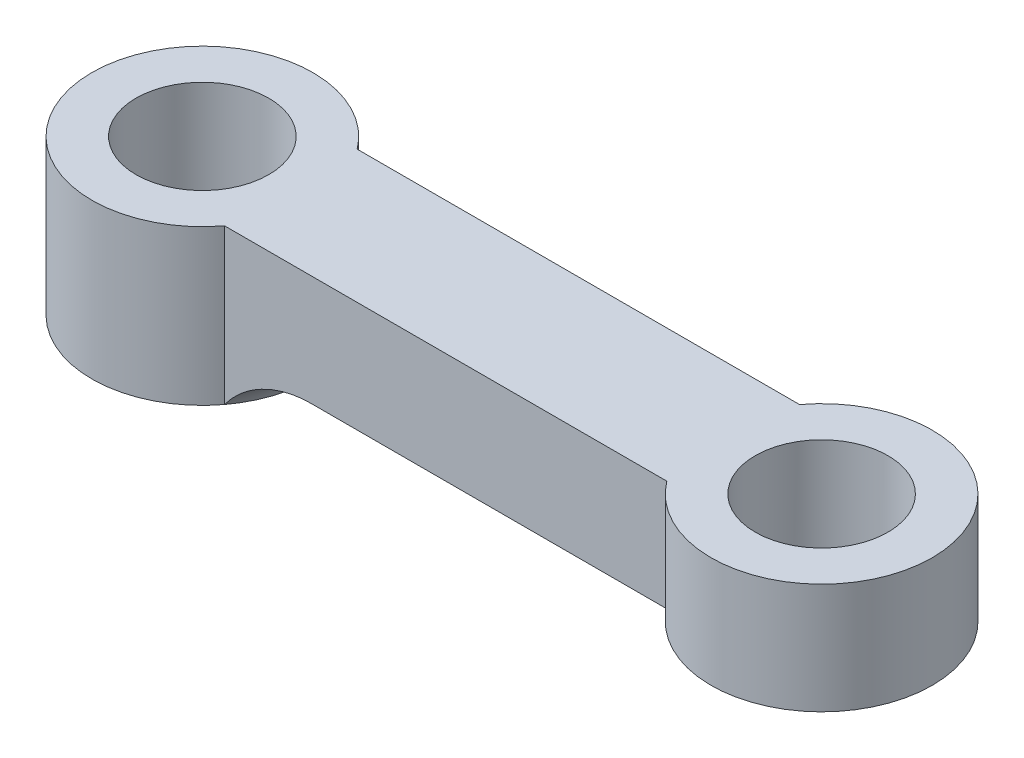
from build123d import *

# Parameters (mm, degrees)
BOSS_EXTRUDE1_DEPTH = 10
BOSS_EXTRUDE2_START = -10
SKETCH3_R           = 2.5
SKETCH3_R_2         = 2
BOSS_EXTRUDE2_DEPTH = 10
MOVE_FACE1_BY       = 5
SKETCH4_R           = 2.5
SKETCH4_R_2         = 1.5
BOSS_EXTRUDE3_DEPTH = 5
SKETCH5_R           = 1.5
CUT_EXTRUDE1_DEPTH  = 5
MOVE_FACE2_BY       = 1
SKETCH11_R          = 1.5
CUT_EXTRUDE2_DEPTH  = 0.75
SKETCH12_R          = 1.5
CUT_EXTRUDE3_DEPTH  = 0.75
FILLET1_R           = 1
SKETCH13_W          = 8
SKETCH13_H          = 3
CUT_EXTRUDE4_DEPTH  = 0.75
SKETCH14_W          = 8
SKETCH14_H          = 3
CUT_EXTRUDE5_DEPTH  = 0.75
BOSS_EXTRUDE6_START = 1
SKETCH16_R          = 2.5
SKETCH16_R_2        = 1.5
BOSS_EXTRUDE6_DEPTH = 1
FILLET3_R           = 2


with BuildPart() as part:
    # Sketch2 → Boss-Extrude1 (new body)
    with BuildSketch(Plane(origin=(0, 0, 0), x_dir=(1, 0, 0), z_dir=(0, 1, 0))):
        with BuildLine():
            Line((0, -1.5), (0, 0))
            Line((0, 0), (-12, 0))
            ThreePointArc((-12, 0), (-12.177124344, -0.822875656), (-12.677124344, -1.5))
            Line((-12.677124344, -1.5), (0, -1.5))
        make_face()
        with BuildLine():
            Line((-12, 0), (0, 0))
            Line((0, 0), (0, 1.5))
            Line((0, 1.5), (-12.677124344, 1.5))
            ThreePointArc((-12.677124344, 1.5), (-12.177124344, 0.822875656), (-12, 0))
        make_face()
        with BuildLine():
            ThreePointArc((-12.677124344, -1.5), (-12.177124344, -0.822875656), (-12, 0))
            Line((-12, 0), (-12.5, 0))
            ThreePointArc((-12.5, 0), (-12.544954729, -0.364476691), (-12.677124344, -0.707106781))
            Line((-12.677124344, -0.707106781), (-12.677124344, -1.5))
        make_face()
        with BuildLine():
            Line((-12.5, 0), (-12, 0))
            ThreePointArc((-12, 0), (-12.177124344, 0.822875656), (-12.677124344, 1.5))
            Line((-12.677124344, 1.5), (-12.677124344, 0.707106781))
            ThreePointArc((-12.677124344, 0.707106781), (-12.544954729, 0.364476691), (-12.5, 0))
        make_face()
        with BuildLine():
            Line((-12.677124344, 0.707106781), (-12.677124344, 1.5))
            ThreePointArc((-12.677124344, 1.5), (-13.292893219, 1.870828693), (-14, 2))
            Line((-14, 2), (-14, 1.5))
            ThreePointArc((-14, 1.5), (-13.228851562, 1.286596318), (-12.677124344, 0.707106781))
        make_face()
        with BuildLine():
            ThreePointArc((-14, -2), (-13.292893219, -1.870828693), (-12.677124344, -1.5))
            Line((-12.677124344, -1.5), (-12.677124344, -0.707106781))
            ThreePointArc((-12.677124344, -0.707106781), (-13.228851562, -1.286596318), (-14, -1.5))
            Line((-14, -1.5), (-14, -2))
        make_face()
        with BuildLine():
            Line((-14, 1.5), (-14, 2))
            ThreePointArc((-14, 2), (-15.414213562, 1.414213562), (-16, 0))
            Line((-16, 0), (-15.5, 0))
            ThreePointArc((-15.5, 0), (-15.060660172, 1.060660172), (-14, 1.5))
        make_face()
        with BuildLine():
            ThreePointArc((-16, 0), (-15.414213562, -1.414213562), (-14, -2))
            Line((-14, -2), (-14, -1.5))
            ThreePointArc((-14, -1.5), (-15.060660172, -1.060660172), (-15.5, 0))
            Line((-15.5, 0), (-16, 0))
        make_face()
    extrude(amount=BOSS_EXTRUDE1_DEPTH)

    # Sketch3 → Boss-Extrude2 (add)
    with BuildSketch(Plane(origin=(0, 10, 0), x_dir=(1, 0, 0), z_dir=(0, 1, 0)).offset(BOSS_EXTRUDE2_START)):
        with Locations((-14, 0)):
            Circle(SKETCH3_R)
        with Locations((-14, 0)):
            Circle(SKETCH3_R_2, mode=Mode.SUBTRACT)
    extrude(amount=BOSS_EXTRUDE2_DEPTH)

    # Move Face1: a face moved inward by 5.0
    extrude(part.faces().sort_by_distance((-7.989839666, 10, 0))[0], amount=MOVE_FACE1_BY, dir=(0, -1, 0), mode=Mode.SUBTRACT)

    # Sketch4 → Boss-Extrude3 (add)
    with BuildSketch(Plane(origin=(0, 5, 0), x_dir=(1, 0, 0), z_dir=(0, 1, 0))):
        Circle(SKETCH4_R)
        Circle(SKETCH4_R_2, mode=Mode.SUBTRACT)
    extrude(amount=-BOSS_EXTRUDE3_DEPTH)

    # Sketch5 → Cut-Extrude1 (cut)
    with BuildSketch(Plane(origin=(0, 5, 0), x_dir=(1, 0, 0), z_dir=(0, 1, 0))):
        with Locations(Location((0, 0, 0), (0, 0, 270))):
            Circle(SKETCH5_R)
    extrude(amount=-CUT_EXTRUDE1_DEPTH, mode=Mode.SUBTRACT)

    # Move Face2: a face moved inward by 1.0
    extrude(part.faces().sort_by_distance((-7, 5, 0))[0], amount=MOVE_FACE2_BY, dir=(0, -1, 0), mode=Mode.SUBTRACT)

    # Sketch11 → Cut-Extrude2 (cut)
    # profile 1 of 2: a face of its own
    with BuildSketch(Plane(origin=(0, 4, 0), x_dir=(1, 0, 0), z_dir=(0, 1, 0))):
        with BuildLine():
            Line((-11, 0), (-11, 1.5))
            Line((-11, 1.5), (-12, 1.5))
            ThreePointArc((-12, 1.5), (-16.5, 0), (-12, -1.5))
            Line((-12, -1.5), (-11, -1.5))
            Line((-11, -1.5), (-11, 0))
        make_face()
        with Locations(Location((-14, 0, 0), (0, 0, 270))):
            Circle(SKETCH11_R, mode=Mode.SUBTRACT)
    # profile 2 of 2: a face of its own
    with BuildSketch(Plane(origin=(0, 4, 0), x_dir=(1, 0, 0), z_dir=(0, 1, 0))):
        with BuildLine():
            Line((-2, 1.5), (-3, 1.5))
            Line((-3, 1.5), (-3, 0))
            Line((-3, 0), (-3, -1.5))
            Line((-3, -1.5), (-2, -1.5))
            ThreePointArc((-2, -1.5), (2.5, 0), (-2, 1.5))
        make_face()
        with Locations(Location((0, 0, 0), (0, 0, 270))):
            Circle(SKETCH11_R, mode=Mode.SUBTRACT)
    extrude(amount=-CUT_EXTRUDE2_DEPTH, mode=Mode.SUBTRACT)

    # Sketch12 → Cut-Extrude3 (cut)
    # profile 1 of 2: a face of its own
    with BuildSketch(Plane(origin=(0, 0, 0), x_dir=(-1, 0, 0), z_dir=(0, -1, 0))):
        with BuildLine():
            Line((11, 1.5), (11, -1.5))
            Line((11, -1.5), (12, -1.5))
            ThreePointArc((12, -1.5), (16.5, 0), (12, 1.5))
            Line((12, 1.5), (11, 1.5))
        make_face()
        with Locations(Location((14, 0, 0), (0, 0, 90))):
            Circle(SKETCH12_R, mode=Mode.SUBTRACT)
    # profile 2 of 2: a face of its own
    with BuildSketch(Plane(origin=(0, 0, 0), x_dir=(-1, 0, 0), z_dir=(0, -1, 0))):
        with BuildLine():
            Line((2, -1.5), (3, -1.5))
            Line((3, -1.5), (3, 1.5))
            Line((3, 1.5), (2, 1.5))
            ThreePointArc((2, 1.5), (-2.5, 0), (2, -1.5))
        make_face()
        with Locations(Location((0, 0, 0), (0, 0, 270))):
            Circle(SKETCH12_R, mode=Mode.SUBTRACT)
    extrude(amount=-CUT_EXTRUDE3_DEPTH, mode=Mode.SUBTRACT)

    # Fillet1
    # the kernel refuses this fillet: 1 mm, written as the material it takes off along each edge
    with BuildSketch(Plane(origin=(-3, 0, 3.920614591), x_dir=(0, 1, 0), z_dir=(0, 0, -1))) as fillet1_piece_1:
        with BuildLine():
            CenterArc((1, -0.968245837), FILLET1_R, 104.477512186, 75.522487814)
            Line((0, -0.968245837), (-0.02, -0.968245837))
            Line((-0.02, -0.968245837), (-0.02, 0))
            Line((-0.02, 0), (0, 0.02))
            ThreePointArc((0, 0.02), (0.375, 0.02), (0.745, 0.019364917))
            Line((0.745, 0.019364917), (0.75, 0))
        make_face()
    extrude(amount=7.841229183, mode=Mode.SUBTRACT)
    with BuildSketch(Plane(origin=(-3, 4, 3.920614591), x_dir=(-1, 0, 0), z_dir=(0, 0, -1))) as fillet1_piece_2:
        with BuildLine():
            CenterArc((0.968245837, -1), FILLET1_R, 90, 75.522487814)
            Line((0, -0.75), (-0.019364917, -0.745))
            ThreePointArc((-0.019364917, -0.745), (-0.02, -0.375), (-0.02, 0))
            Line((-0.02, 0), (0, 0.02))
            Line((0, 0.02), (0.968245837, 0.02))
            Line((0.968245837, 0.02), (0.968245837, 0))
        make_face()
    extrude(amount=7.841229183, mode=Mode.SUBTRACT)
    with BuildSketch(Plane(origin=(-11, 0, -3.920614591), x_dir=(1, 0, 0), z_dir=(0, 0, 1))) as fillet1_piece_3:
        with BuildLine():
            CenterArc((0.968245837, 1), FILLET1_R, 194.477512186, 75.522487814)
            Line((0, 0.75), (-0.019364917, 0.745))
            ThreePointArc((-0.019364917, 0.745), (-0.02, 0.375), (-0.02, 0))
            Line((-0.02, 0), (0, -0.02))
            Line((0, -0.02), (0.968245837, -0.02))
            Line((0.968245837, -0.02), (0.968245837, 0))
        make_face()
    extrude(amount=7.841229183, mode=Mode.SUBTRACT)
    with BuildSketch(Plane(origin=(-11, 4, -3.920614591), x_dir=(0, -1, 0), z_dir=(0, 0, 1))) as fillet1_piece_4:
        with BuildLine():
            CenterArc((1, 0.968245837), FILLET1_R, 180, 75.522487814)
            Line((0, 0.968245837), (-0.02, 0.968245837))
            Line((-0.02, 0.968245837), (-0.02, 0))
            Line((-0.02, 0), (0, -0.02))
            ThreePointArc((0, -0.02), (0.375, -0.02), (0.745, -0.019364917))
            Line((0.745, -0.019364917), (0.75, 0))
        make_face()
    extrude(amount=7.841229183, mode=Mode.SUBTRACT)

    # Sketch13 → Cut-Extrude4 (cut)
    with BuildSketch(Plane(origin=(0, 0, 0), x_dir=(-1, 0, 0), z_dir=(0, -1, 0))):
        with Locations((7, 0)):
            Rectangle(SKETCH13_W, SKETCH13_H)
    extrude(amount=-CUT_EXTRUDE4_DEPTH, mode=Mode.SUBTRACT)

    # Sketch14 → Cut-Extrude5 (cut)
    with BuildSketch(Plane(origin=(0, 4, 0), x_dir=(1, 0, 0), z_dir=(0, 1, 0))):
        with Locations((-7, 0)):
            Rectangle(SKETCH14_W, SKETCH14_H)
    extrude(amount=-CUT_EXTRUDE5_DEPTH, mode=Mode.SUBTRACT)

    # Sketch16 → Boss-Extrude6 (add)
    with BuildSketch(Plane(origin=(0, 0.75, 0), x_dir=(-1, 0, 0), z_dir=(0, -1, 0)).offset(BOSS_EXTRUDE6_START)):
        with Locations(Location((14, 0, 0), (0, 0, 216.869897646))):
            Circle(SKETCH16_R)
        with Locations(Location((14, 0, 0), (0, 0, 90))):
            Circle(SKETCH16_R_2, mode=Mode.SUBTRACT)
    extrude(amount=-BOSS_EXTRUDE6_DEPTH)

    # Fillet3
    # the kernel refuses this fillet: 2 mm, written as the material it adds along each edge
    with BuildSketch(Plane(origin=(-14, 0.75, 0), x_dir=(-0.720984929131136, 0, -0.6929507428134924), z_dir=(-0.6929507428134924, 0, 0.720984929131136))) as fillet3_piece_1_section:
        with BuildLine():
            CenterArc((4.232050808, 2), FILLET3_R, 210, 60)
            Line((4.232050808, 0), (4.232050808, -0.04))
            Line((4.232050808, -0.04), (2.5, -0.04))
            Line((2.5, -0.04), (2.46, 0))
            ThreePointArc((2.46, 0), (2.46, 0.5), (2.465358984, 0.98))
            Line((2.465358984, 0.98), (2.5, 1))
        make_face()
    fillet3_piece_1 = revolve(axis=Axis((-14, 0.75, 0), (0, -1, 0)), revolution_arc=272.27171598, mode=Mode.PRIVATE)
    fillet3_piece_1 = split(fillet3_piece_1, bisect_by=Plane(origin=(-11.214858776, 0.489042262, 1.5), z_dir=(0, 0, -1)), keep=Keep.TOP, mode=Mode.PRIVATE)
    fillet3_piece_1 = split(fillet3_piece_1, bisect_by=Plane(origin=(-11.214858776, 0.489042262, -1.5), z_dir=(0, 0, 1)), keep=Keep.TOP, mode=Mode.PRIVATE)
    add(fillet3_piece_1)


solid = part.part
